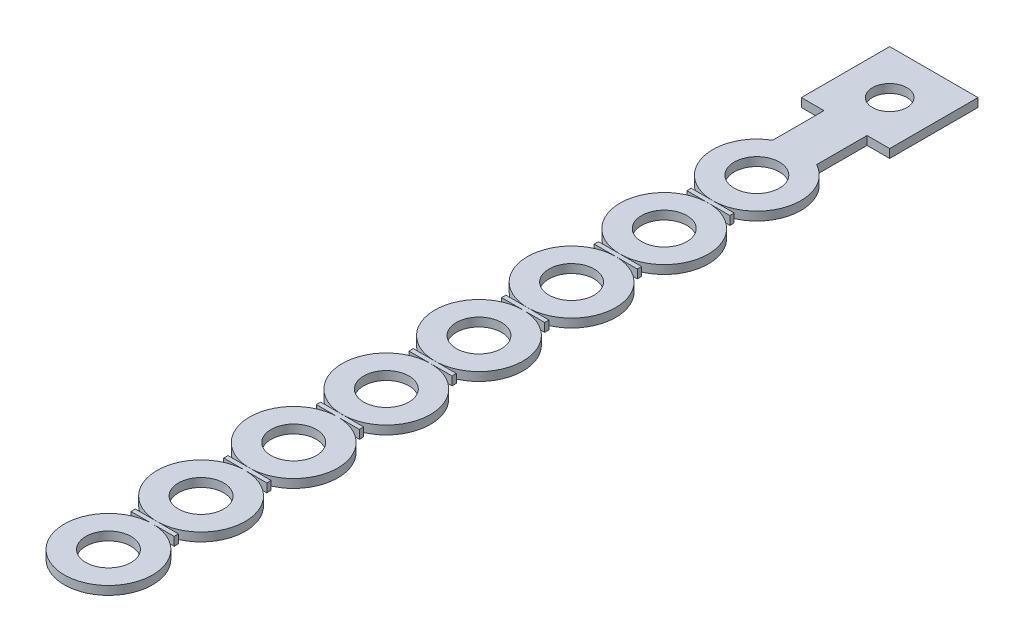
from build123d import *

# Parameters (mm, degrees)
SKETCH1_W               = 20.5
SKETCH1_H               = 20.5
BOSS_EXTRUDE1_DEPTH     = 2
SKETCH2_R               = 4
CUT_EXTRUDE1_DEPTH      = 2
SKETCH3_W               = 10
SKETCH3_H               = 2
BOSS_EXTRUDE2_DEPTH     = 12.5
SKETCH6_R               = 10.25
BOSS_EXTRUDE3_DEPTH     = 2
SKETCH7_R               = 5.25
CUT_EXTRUDE2_DEPTH      = 2
SKETCH8_W               = 10
SKETCH8_H               = 2
BOSS_EXTRUDE4_DEPTH     = 1
LPATTERN1_START         = -2
LPATTERN1_OUTLINE_R     = 5.25
LPATTERN1_DEPTH         = 2
LPATTERN1_2_OUTLINE_R   = 5.25
LPATTERN1_2_DEPTH       = 2
LPATTERN1_3_OUTLINE_R   = 5.25
LPATTERN1_3_DEPTH       = 2
LPATTERN1_4_OUTLINE_R   = 5.25
LPATTERN1_4_DEPTH       = 2
LPATTERN1_5_OUTLINE_R   = 5.25
LPATTERN1_5_DEPTH       = 2
LPATTERN1_6_OUTLINE_R   = 5.25
LPATTERN1_6_DEPTH       = 2
LPATTERN1_7_OUTLINE_R   = 10.25
LPATTERN1_7_OUTLINE_R_2 = 5.25
LPATTERN1_7_DEPTH       = 2


with BuildPart() as part:
    # Sketch1 → Boss-Extrude1 (new body)
    with BuildSketch(Plane(origin=(0, 0, 0), x_dir=(1, 0, 0), z_dir=(0, 1, 0))):
        with Locations((10.25, 10.25)):
            Rectangle(SKETCH1_W, SKETCH1_H)
    extrude(amount=-BOSS_EXTRUDE1_DEPTH)

    # Sketch2 → Cut-Extrude1 (cut)
    with BuildSketch(Plane(origin=(0, 0, 0), x_dir=(1, 0, 0), z_dir=(0, 1, 0))):
        with Locations(Location((10.25, 10.25, 0), (0, 0, 270))):
            Circle(SKETCH2_R)
    extrude(amount=-CUT_EXTRUDE1_DEPTH, mode=Mode.SUBTRACT)

    # Sketch3 → Boss-Extrude2 (add)
    with BuildSketch(Plane.XY):
        with Locations((10.25, -1)):
            Rectangle(SKETCH3_W, SKETCH3_H)
    extrude(amount=BOSS_EXTRUDE2_DEPTH)


with BuildPart() as body_2:
    # Sketch6 → Boss-Extrude3 (new body)
    with BuildSketch(Plane(origin=(0, 0, 0), x_dir=(1, 0, 0), z_dir=(0, 1, 0))):
        with Locations(Location((10.417474337, -20.75, 0), (0, 0, 270))):
            Circle(SKETCH6_R)
    extrude(amount=-BOSS_EXTRUDE3_DEPTH)


with BuildPart() as part_1:
    add(part.part)

    # Intersect2: read off the stored shape, not the designer's step
    # Intersect2: union body 2
    add(body_2.part)

    # Sketch7 → Cut-Extrude2 (cut)
    with BuildSketch(Plane(origin=(0, 0, 0), x_dir=(1, 0, 0), z_dir=(0, 1, 0))):
        with Locations(Location((10.417474337, -20.75, 0), (0, 0, 270))):
            Circle(SKETCH7_R)
    extrude(amount=-CUT_EXTRUDE2_DEPTH, mode=Mode.SUBTRACT)


with BuildPart() as body_2_2:
    # Sketch8 → Boss-Extrude4 (new body)
    with BuildSketch(Plane.XY.offset(31)):
        with Locations((10.417474337, -1)):
            Rectangle(SKETCH8_W, SKETCH8_H)
    extrude(amount=BOSS_EXTRUDE4_DEPTH)


with BuildPart() as body_3:
    # LPattern1: read off the stored shape, not the designer's step
    # LPattern1 outline → LPattern1 (new body)
    with BuildSketch(Plane(origin=(0, 0, 0), x_dir=(1, 0, 0), z_dir=(0, 1, 0)).offset(LPATTERN1_START)):
        with BuildLine():
            Line((5.417474337, -160.994), (10.274299619, -160.994))
            ThreePointArc((10.274299619, -160.994), (10.417474338, -181.493), (10.560649056, -160.994))
            Line((10.560649056, -160.994), (15.417474337, -160.994))
            Line((15.417474337, -160.994), (15.417474337, -159.994))
            Line((15.417474337, -159.994), (5.417474337, -159.994))
            Line((5.417474337, -159.994), (5.417474337, -160.994))
        make_face()
        with Locations((10.417474337, -171.243)):
            Circle(LPATTERN1_OUTLINE_R, mode=Mode.SUBTRACT)
    extrude(amount=LPATTERN1_DEPTH)


with BuildPart() as body_4:
    # LPattern1 2 outline → LPattern1 2 (new body)
    with BuildSketch(Plane(origin=(0, 0, 0), x_dir=(1, 0, 0), z_dir=(0, 1, 0)).offset(LPATTERN1_START)):
        with BuildLine():
            Line((5.417474337, -139.495), (10.274299619, -139.495))
            ThreePointArc((10.274299619, -139.495), (10.417474338, -159.994), (10.560649056, -139.495))
            Line((10.560649056, -139.495), (15.417474337, -139.495))
            Line((15.417474337, -139.495), (15.417474337, -138.495))
            Line((15.417474337, -138.495), (5.417474337, -138.495))
            Line((5.417474337, -138.495), (5.417474337, -139.495))
        make_face()
        with Locations((10.417474337, -149.744)):
            Circle(LPATTERN1_2_OUTLINE_R, mode=Mode.SUBTRACT)
    extrude(amount=LPATTERN1_2_DEPTH)


with BuildPart() as body_5:
    # LPattern1 3 outline → LPattern1 3 (new body)
    with BuildSketch(Plane(origin=(0, 0, 0), x_dir=(1, 0, 0), z_dir=(0, 1, 0)).offset(LPATTERN1_START)):
        with BuildLine():
            Line((5.417474337, -117.996), (10.274299619, -117.996))
            ThreePointArc((10.274299619, -117.996), (10.417474338, -138.495), (10.560649056, -117.996))
            Line((10.560649056, -117.996), (15.417474337, -117.996))
            Line((15.417474337, -117.996), (15.417474337, -116.996))
            Line((15.417474337, -116.996), (5.417474337, -116.996))
            Line((5.417474337, -116.996), (5.417474337, -117.996))
        make_face()
        with Locations((10.417474337, -128.245)):
            Circle(LPATTERN1_3_OUTLINE_R, mode=Mode.SUBTRACT)
    extrude(amount=LPATTERN1_3_DEPTH)


with BuildPart() as body_6:
    # LPattern1 4 outline → LPattern1 4 (new body)
    with BuildSketch(Plane(origin=(0, 0, 0), x_dir=(1, 0, 0), z_dir=(0, 1, 0)).offset(LPATTERN1_START)):
        with BuildLine():
            Line((5.417474337, -96.497), (10.274299619, -96.497))
            ThreePointArc((10.274299619, -96.497), (10.417474338, -116.996), (10.560649056, -96.497))
            Line((10.560649056, -96.497), (15.417474337, -96.497))
            Line((15.417474337, -96.497), (15.417474337, -95.497))
            Line((15.417474337, -95.497), (5.417474337, -95.497))
            Line((5.417474337, -95.497), (5.417474337, -96.497))
        make_face()
        with Locations((10.417474337, -106.746)):
            Circle(LPATTERN1_4_OUTLINE_R, mode=Mode.SUBTRACT)
    extrude(amount=LPATTERN1_4_DEPTH)


with BuildPart() as body_7:
    # LPattern1 5 outline → LPattern1 5 (new body)
    with BuildSketch(Plane(origin=(0, 0, 0), x_dir=(1, 0, 0), z_dir=(0, 1, 0)).offset(LPATTERN1_START)):
        with BuildLine():
            Line((5.417474337, -74.998), (10.274299619, -74.998))
            ThreePointArc((10.274299619, -74.998), (10.417474338, -95.497), (10.560649056, -74.998))
            Line((10.560649056, -74.998), (15.417474337, -74.998))
            Line((15.417474337, -74.998), (15.417474337, -73.998))
            Line((15.417474337, -73.998), (5.417474337, -73.998))
            Line((5.417474337, -73.998), (5.417474337, -74.998))
        make_face()
        with Locations((10.417474337, -85.247)):
            Circle(LPATTERN1_5_OUTLINE_R, mode=Mode.SUBTRACT)
    extrude(amount=LPATTERN1_5_DEPTH)


with BuildPart() as body_8:
    # LPattern1 6 outline → LPattern1 6 (new body)
    with BuildSketch(Plane(origin=(0, 0, 0), x_dir=(1, 0, 0), z_dir=(0, 1, 0)).offset(LPATTERN1_START)):
        with BuildLine():
            Line((5.417474337, -53.499), (10.274299619, -53.499))
            ThreePointArc((10.274299619, -53.499), (10.417474338, -73.998), (10.560649056, -53.499))
            Line((10.560649056, -53.499), (15.417474337, -53.499))
            Line((15.417474337, -53.499), (15.417474337, -52.499))
            Line((15.417474337, -52.499), (5.417474337, -52.499))
            Line((5.417474337, -52.499), (5.417474337, -53.499))
        make_face()
        with Locations((10.417474337, -63.748)):
            Circle(LPATTERN1_6_OUTLINE_R, mode=Mode.SUBTRACT)
    extrude(amount=LPATTERN1_6_DEPTH)


with BuildPart() as body_9:
    # LPattern1 7 outline → LPattern1 7 (new body)
    with BuildSketch(Plane(origin=(0, 0, 0), x_dir=(1, 0, 0), z_dir=(0, 1, 0)).offset(LPATTERN1_START)):
        with Locations((10.417474337, -42.249)):
            Circle(LPATTERN1_7_OUTLINE_R)
        with Locations((10.417474337, -42.249)):
            Circle(LPATTERN1_7_OUTLINE_R_2, mode=Mode.SUBTRACT)
    extrude(amount=LPATTERN1_7_DEPTH)


solid = Compound([part_1.part, body_2_2.part, body_3.part, body_4.part, body_5.part, body_6.part, body_7.part, body_8.part, body_9.part])
